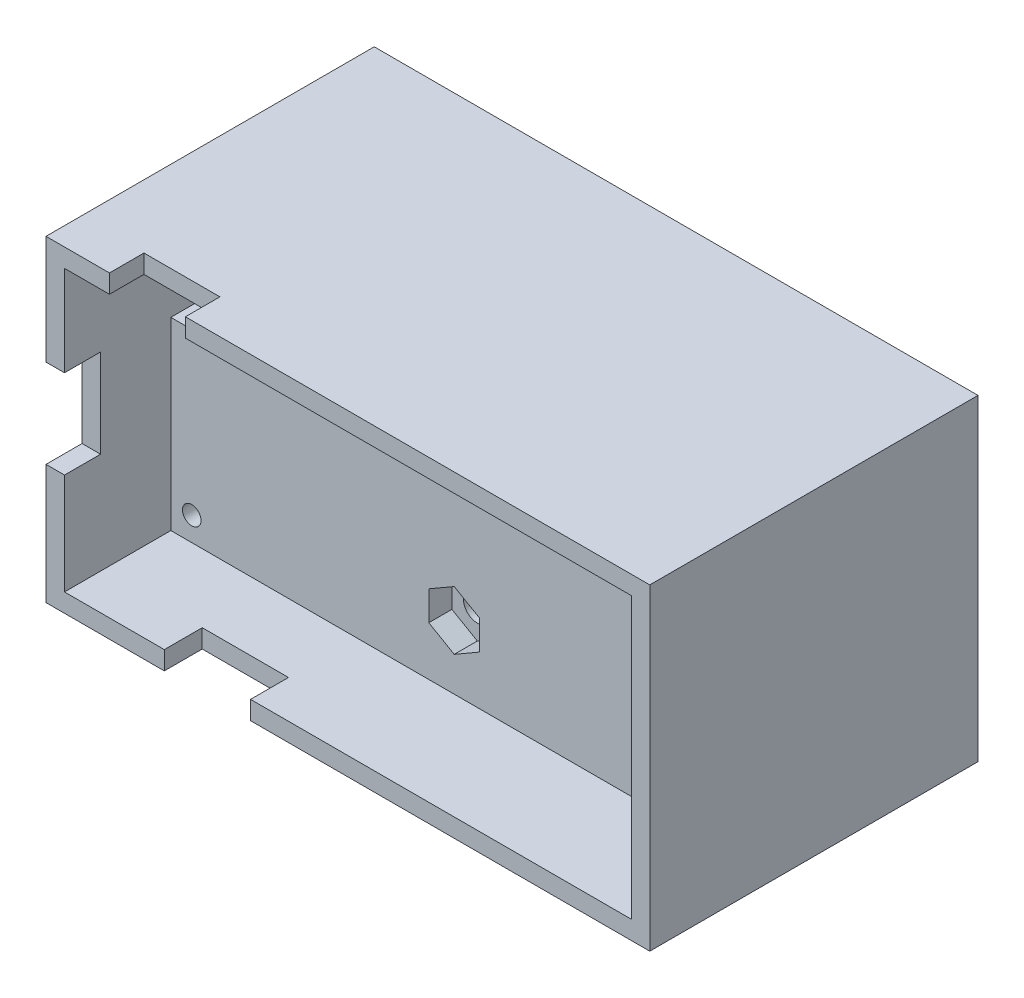
from build123d import *

# Parameters (mm, degrees)
SKETCH_2_W           = 65.2997206
SKETCH_2_H           = 34.311658624
SKETCH_2_R           = 1.00000254
SKETCH_2_R_2         = 1.5
SKETCH_2_R_3         = 0.922218434
EXTRUDE_2_DEPTH      = 4.5
CUT_EXTRUDE_2_DEPTH  = 2.5
EXTRUDE_3_DEPTH      = 15.5
EXTRUDE_3_DEPTH_BACK = 16
SKETCH_5_W           = 65.2997206
SKETCH_5_H           = 34.311658624
SKETCH_5_W_2         = 61.2997206
SKETCH_5_H_2         = 30.311658624
SKETCH_7_W           = 8.214112973
SKETCH_7_H           = 3.795011114
CUT_EXTRUDE_4_DEPTH  = 3
SKETCH_8_W           = 4
SKETCH_8_H           = 9.575559499
CUT_EXTRUDE_5_DEPTH  = 3
SKETCH_9_W           = 9.326303795
SKETCH_9_H           = 4.202278939
CUT_EXTRUDE_6_DEPTH  = 3
SKETCH_10_W          = 65.2997206
SKETCH_10_H          = 34.311658624
SKETCH_10_R          = 1
EXTRUDE_4_DEPTH      = 4
SKETCH_13_W          = 4.234944145
SKETCH_13_H          = 5.449117784
CUT_EXTRUDE_7_DEPTH  = 10


with BuildPart() as part:
    # 草图2 → 凸台-拉伸2 (new body)
    with BuildSketch(Plane(origin=(0, 0, -6), x_dir=(-1, 0, 0), z_dir=(0, 0, -1))):
        with Locations((29.273558547, -24.066548133)):
            Rectangle(SKETCH_2_W, SKETCH_2_H)
        with Locations((0.889001778, -36.83007366)):
            Circle(SKETCH_2_R, mode=Mode.SUBTRACT)
        with Locations((57.658115316, -36.64983236)):
            Circle(SKETCH_2_R, mode=Mode.SUBTRACT)
        with Locations((29.273558547, -32.316548133)):
            Circle(SKETCH_2_R_2, mode=Mode.SUBTRACT)
        with Locations((1.016002032, -11.24978156)):
            Circle(SKETCH_2_R, mode=Mode.SUBTRACT)
        with BuildLine():
            ThreePointArc((30.761710061, -15.816548133), (29.273558547, -17.304699647), (27.785407033, -15.816548133))
            Line((27.785407033, -15.816548133), (27.785407033, -13.183619987))
            ThreePointArc((27.785407033, -13.183619987), (29.273558547, -11.695468472), (30.761710061, -13.183619987))
            Line((30.761710061, -13.183619987), (30.761710061, -15.816548133))
        make_face(mode=Mode.SUBTRACT)
        with Locations((57.658115316, -11.24978156)):
            Circle(SKETCH_2_R_3, mode=Mode.SUBTRACT)
    extrude(amount=EXTRUDE_2_DEPTH)

    # 草图3 → 切除-拉伸2 (cut)
    with BuildSketch(Plane(origin=(0, 0, -6), x_dir=(-1, 0, 0), z_dir=(0, 0, -1))):
        Polygon((29.273558547, -18.991974614), (32.023558547, -17.404261373), (32.023558547, -14.920341582), (32.023558547, -14.228834893), (32.023558547, -11.744915102), (29.273558547, -10.157201862), (26.523558547, -11.744915102), (26.523558547, -14.228834893), (26.523558547, -14.920341582), (26.523558547, -17.404261373), align=None)
        Polygon((26.523558547, -30.728834893), (26.523558547, -33.904261373), (29.273558547, -35.491974614), (32.023558547, -33.904261373), (32.023558547, -30.728834893), (29.273558547, -29.141121653), align=None)
    extrude(amount=CUT_EXTRUDE_2_DEPTH, mode=Mode.SUBTRACT)

    # 草图5 → 凸台-拉伸3 (add, two sides: drawn at the far end of the back side and taken through both)
    with BuildSketch(Plane(origin=(0, 0, -10.5), x_dir=(-1, 0, 0), z_dir=(0, 0, -1)).offset(-EXTRUDE_3_DEPTH_BACK)):
        with Locations((29.273558547, -24.066548133)):
            Rectangle(SKETCH_5_W, SKETCH_5_H)
        with Locations((29.273558547, -24.066548133)):
            Rectangle(SKETCH_5_W_2, SKETCH_5_H_2, mode=Mode.SUBTRACT)
    extrude(amount=EXTRUDE_3_DEPTH + EXTRUDE_3_DEPTH_BACK)

    # 草图7 → 切除-拉伸4 (cut)
    with BuildSketch(Plane(origin=(0, -6.910718821, 0), x_dir=(1, 0, 0), z_dir=(0, 1, 0))):
        with Locations((-50.955145133, -3.662545243)):
            Rectangle(SKETCH_7_W, SKETCH_7_H)
    extrude(amount=-CUT_EXTRUDE_4_DEPTH, mode=Mode.SUBTRACT)

    # 草图8 → 切除-拉伸5 (cut)
    with BuildSketch(Plane.ZY.offset(61.923418847)):
        with Locations((3.6000508, -23.483057223)):
            Rectangle(SKETCH_8_W, SKETCH_8_H)
    extrude(amount=-CUT_EXTRUDE_5_DEPTH, mode=Mode.SUBTRACT)

    # 草图9 → 切除-拉伸6 (cut)
    with BuildSketch(Plane.XZ.offset(41.222377445)):
        with Locations((-44.464129124, 3.49891133)):
            Rectangle(SKETCH_9_W, SKETCH_9_H)
    extrude(amount=-CUT_EXTRUDE_6_DEPTH, mode=Mode.SUBTRACT)

    # 草图10 → 凸台-拉伸4 (add)
    with BuildSketch(Plane(origin=(0, 0, -26), x_dir=(-1, 0, 0), z_dir=(0, 0, -1))):
        with Locations((29.273558547, -24.066548133)):
            Rectangle(SKETCH_10_W, SKETCH_10_H)
        with BuildLine():
            Line((-1.376301753, -33.222377445), (-1.376301753, -14.910718821))
            ThreePointArc((-1.376301753, -14.910718821), (2.866338935, -13.153359509), (4.623698247, -8.910718821))
            Line((4.623698247, -8.910718821), (53.923418847, -8.910718821))
            ThreePointArc((53.923418847, -8.910718821), (55.68077816, -13.153359509), (59.923418847, -14.910718821))
            Line((59.923418847, -14.910718821), (59.923418847, -33.222377445))
            ThreePointArc((59.923418847, -33.222377445), (55.68077816, -34.979736758), (53.923418847, -39.222377445))
            Line((53.923418847, -39.222377445), (4.623698247, -39.222377445))
            ThreePointArc((4.623698247, -39.222377445), (2.866338935, -34.979736758), (-1.376301753, -33.222377445))
        make_face(mode=Mode.SUBTRACT)
        with Locations((1.016002032, -11.24978156)):
            Circle(SKETCH_10_R, mode=Mode.SUBTRACT)
        with Locations((1.016002032, -36.883314707)):
            Circle(SKETCH_10_R, mode=Mode.SUBTRACT)
        with Locations((57.658115316, -36.883314707)):
            Circle(SKETCH_10_R, mode=Mode.SUBTRACT)
        with Locations((57.658115316, -11.24978156)):
            Circle(SKETCH_10_R, mode=Mode.SUBTRACT)
    extrude(amount=EXTRUDE_4_DEPTH)

    # 草图13 → 切除-拉伸7 (cut)
    with BuildSketch(Plane.XY.offset(-6)):
        with Locations((-57.805946775, -16.527557039)):
            Rectangle(SKETCH_13_W, SKETCH_13_H)
    extrude(amount=-CUT_EXTRUDE_7_DEPTH, mode=Mode.SUBTRACT)


solid = part.part
